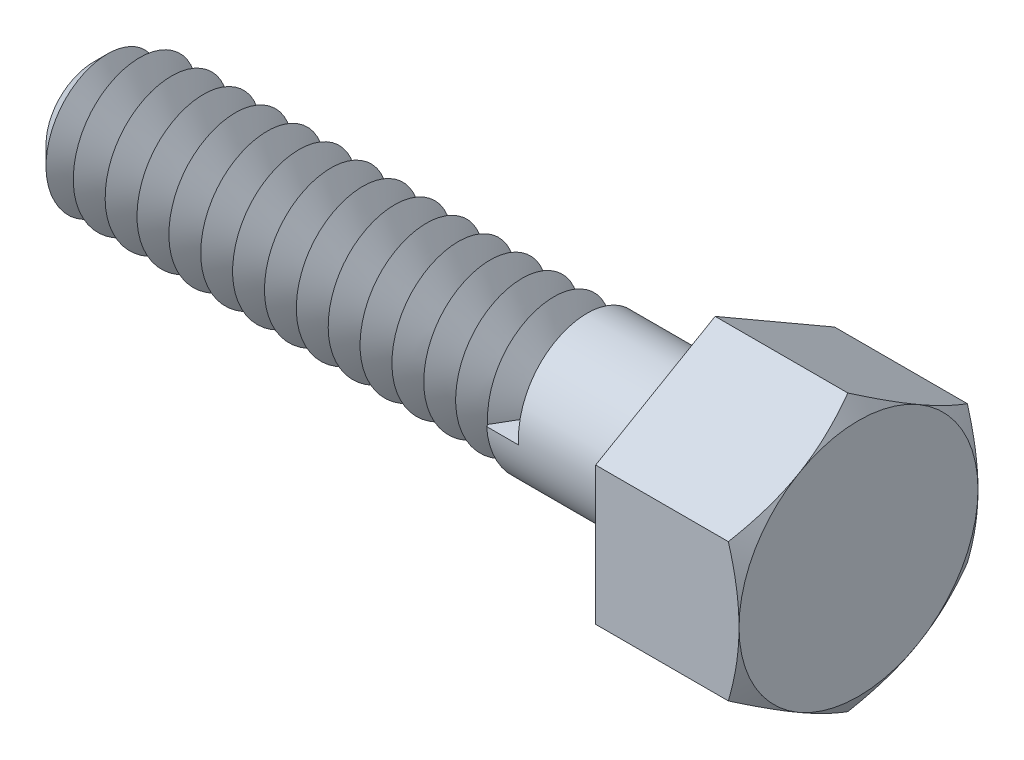
from build123d import *

# Parameters (mm, degrees)
BOSS_EXTRUDE1_DEPTH = 3
SKETCH3_OUTSIDE_W   = 19.034
SKETCH3_OUTSIDE_H   = 19.808
SKETCH3_OUTSIDE_R   = 2.499999999999995
CUT_EXTRUDE1_DEPTH  = 3
CUT_EXTRUDE1_DRAFT  = -60.000000000000135
SKETCH4_R           = 1.5
BOSS_EXTRUDE2_DEPTH = 13
CHAMFER1_SIZE       = 0.5
CUT_SWEEP1_PITCH    = 0.6666666666666679


with BuildPart() as part:
    # Sketch2 → Boss-Extrude1 (new body)
    with BuildSketch(Plane(origin=(0, 0, 0), x_dir=(0, 0, -1), z_dir=(1, 0, 0))):
        Polygon((-7.91e-15, -2.8867513459481278), (2.499999999999995, -1.443375672974062), (2.499999999999995, 1.4433756729740672), (-1.038e-14, 2.8867513459481344), (-2.5000000000000058, 1.4433756729740708), (-2.500000000000002, -1.4433756729740657), align=None)
    extrude(amount=BOSS_EXTRUDE1_DEPTH)


with BuildPart() as cut_extrude1_tool:
    # Sketch3 outside → Cut-Extrude1 (with draft: the straight prism first)
    with BuildSketch(Plane(origin=(3, 0, 0), x_dir=(0, 0, -1), z_dir=(1, 0, 0))):
        Rectangle(SKETCH3_OUTSIDE_W, SKETCH3_OUTSIDE_H)
        Circle(SKETCH3_OUTSIDE_R, mode=Mode.SUBTRACT)
    extrude(amount=-CUT_EXTRUDE1_DEPTH)
    # Cut-Extrude1: the draft: its side faces are tilted about the plane it starts from
    cut_extrude1_sides = [cut_extrude1_tool.faces().sort_by_distance(p)[0] for p in [
        (1.5, -9.904, 0),
        (1.5, 0, -9.517),
        (1.5, 9.904, 0),
        (1.5, 0, 9.517),
        (1.5, 0, 2.5),
    ]]
    draft(cut_extrude1_sides, Plane(origin=(3, 0, 0), x_dir=(0, 0, -1), z_dir=(1, 0, 0)), CUT_EXTRUDE1_DRAFT)


with BuildPart() as part_1:
    add(part.part)

    # Cut-Extrude1: cut by cut_extrude1_tool
    add(cut_extrude1_tool.part, mode=Mode.SUBTRACT)

    # Sketch4 → Boss-Extrude2 (add)
    with BuildSketch(Plane.ZY):
        with Locations(Location((0, 0, 0), (0, 0, 180))):
            Circle(SKETCH4_R)
    extrude(amount=BOSS_EXTRUDE2_DEPTH)

    # Chamfer1
    chamfer1_edges = [part_1.edges().sort_by_distance(p)[0] for p in [
        (-13, -3.7e-16, 1.5),
    ]]
    chamfer(chamfer1_edges, length=CHAMFER1_SIZE)

    # Cut-Sweep1: arcs per turn and ends read off the stored shape
    # Cut-Sweep1: the profile of Sketch6 screwed along a right-hand helix through 16 turns, 6 arcs to a turn; built about Z, then put on its axis
    cut_sweep1_z = Axis((0, 0, 0), (0, 0, 1))
    cut_sweep1_corners = [(0.874282759, 0, 0.029759157), (1.737878334, 0, -0.474426009), (1.742717709, 0, 0.525562281)]
    with BuildLine(mode=Mode.PRIVATE) as cut_sweep1_profile:
        Line(cut_sweep1_corners[0], cut_sweep1_corners[1])
        Line(cut_sweep1_corners[1], cut_sweep1_corners[2])
        Line(cut_sweep1_corners[2], cut_sweep1_corners[0])
    cut_sweep1_cap = Face(cut_sweep1_profile.wire())
    cut_sweep1_turn_angles = [0, 30, 60, 90, 120, 150, 180, 210, 240, 270, 300, 330, 360]
    cut_sweep1_turn_weights = [1, 0.8660254037844387, 1, 0.8660254037844387, 1, 0.8660254037844387, 1, 0.8660254037844387, 1, 0.8660254037844387, 1, 0.8660254037844387, 1]
    cut_sweep1_turn_rails = [Edge.make_bspline([Vector(p[0], p[1], 0).rotate(cut_sweep1_z, cut_sweep1_turn_angles[k]) / cut_sweep1_turn_weights[k] + Vector(0, 0, p[2] + CUT_SWEEP1_PITCH * cut_sweep1_turn_angles[k] / 360) for k in range(13)], [0, 0, 0, 1, 1, 2, 2, 3, 3, 4, 4, 5, 5, 6, 6, 6], 2, cut_sweep1_turn_weights) for p in cut_sweep1_corners]
    cut_sweep1_turn_sides = [Face.make_surface_from_curves(cut_sweep1_turn_rails[p[0]], cut_sweep1_turn_rails[p[1]]) for p in [(0, 1), (1, 2), (2, 0)]]
    cut_sweep1_turn = Solid(Shell([*cut_sweep1_turn_sides, cut_sweep1_cap, cut_sweep1_cap.rotate(cut_sweep1_z, 360).moved(Location((0, 0, CUT_SWEEP1_PITCH * 360 / 360)))]))
    cut_sweep1_each = [*[cut_sweep1_turn.moved(Location((0, 0, CUT_SWEEP1_PITCH * i))) for i in range(16)]]
    add(Plane(origin=(-13, 0, 0), x_dir=(0, 0, 1), z_dir=(1, 0, 0)) * Compound([cut_sweep1_each[i] for i in range(0, 16, 2)]), mode=Mode.SUBTRACT)
    add(Plane(origin=(-13, 0, 0), x_dir=(0, 0, 1), z_dir=(1, 0, 0)) * Compound([cut_sweep1_each[i] for i in range(1, 16, 2)]), mode=Mode.SUBTRACT)


solid = part_1.part
